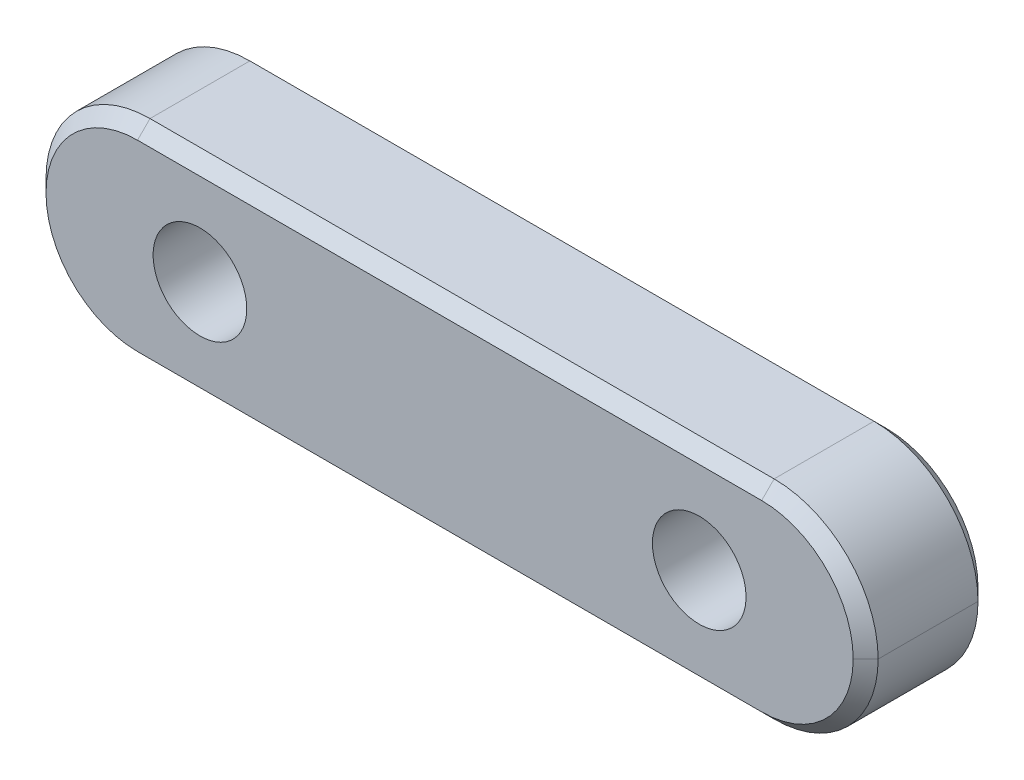
from build123d import *

# Parameters (mm, degrees)
SKETCH1_W           = 40
SKETCH1_H           = 10
BOSS_EXTRUDE1_DEPTH = 6
SKETCH2_R           = 2.25
CUT_EXTRUDE1_DEPTH  = 6
FILLET1_R           = 5
CHAMFER1_SIZE       = 0.6


with BuildPart() as part:
    # Sketch1 → Boss-Extrude1 (new body)
    with BuildSketch(Plane.XY):
        Rectangle(SKETCH1_W, SKETCH1_H)
    extrude(amount=BOSS_EXTRUDE1_DEPTH)

    # Sketch2 → Cut-Extrude1 (cut)
    with BuildSketch(Plane.XY.offset(6)):
        with Locations((-12, 0)):
            Circle(SKETCH2_R)
        with Locations(Location((12, 0, 0), (0, 0, 180))):
            Circle(SKETCH2_R)
    extrude(amount=-CUT_EXTRUDE1_DEPTH, mode=Mode.SUBTRACT)

    # Fillet1
    fillet1_edges = [part.edges().sort_by_distance(p)[0] for p in [
        (20, -5, 3),
        (20, 5, 3),
        (-20, -5, 3),
        (-20, 5, 3),
    ]]
    fillet(fillet1_edges, radius=FILLET1_R - 0.0001)  # a hair under: the kernel refuses the full size

    # Chamfer1
    chamfer1_edges = [part.edges().sort_by_distance(p)[0] for p in [
        (0, -5, 0),
        (0, 5, 0),
        (-18.535563195, 3.535563195, 0),
        (-18.535563195, -3.535563195, 0),
        (18.535563195, 3.535563195, 0),
        (18.535563195, -3.535563195, 0),
        (0, -5, 6),
        (0, 5, 6),
        (-18.535563195, 3.535563195, 6),
        (-18.535563195, -3.535563195, 6),
        (18.535563195, 3.535563195, 6),
        (18.535563195, -3.535563195, 6),
    ]]
    chamfer(chamfer1_edges, length=CHAMFER1_SIZE)


solid = part.part
